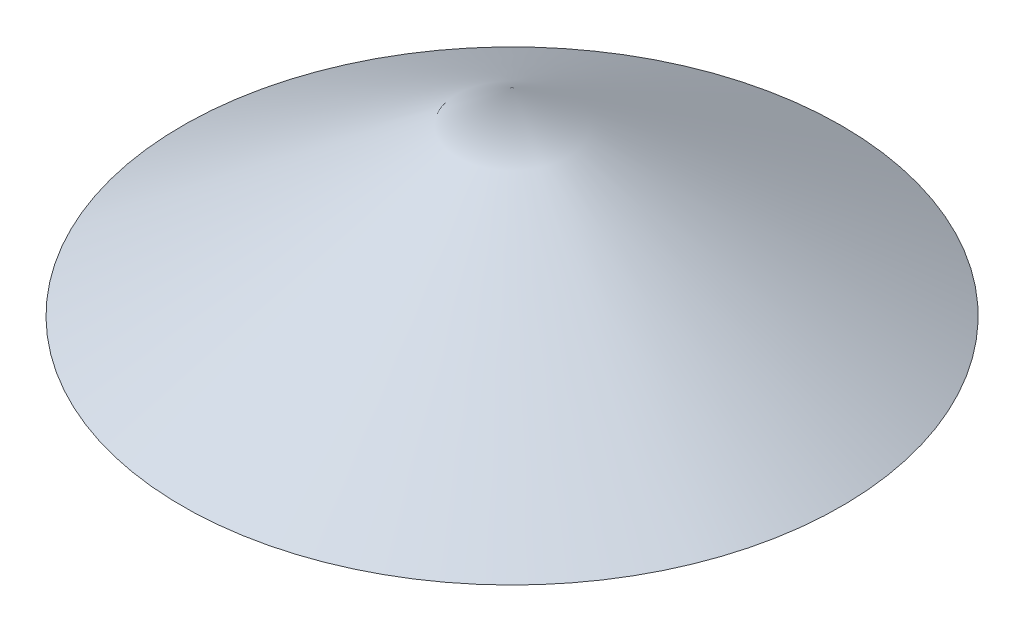
from build123d import *


with BuildPart() as part:
    # Sketch1 → Revolve1 (revolve)
    with BuildSketch(Plane.XY):
        Polygon((0, 0), (0, 38.1), (63.5, 0), align=None)
    revolve(axis=Axis((0, 0, 0), (0, 1, 0)))


solid = part.part
